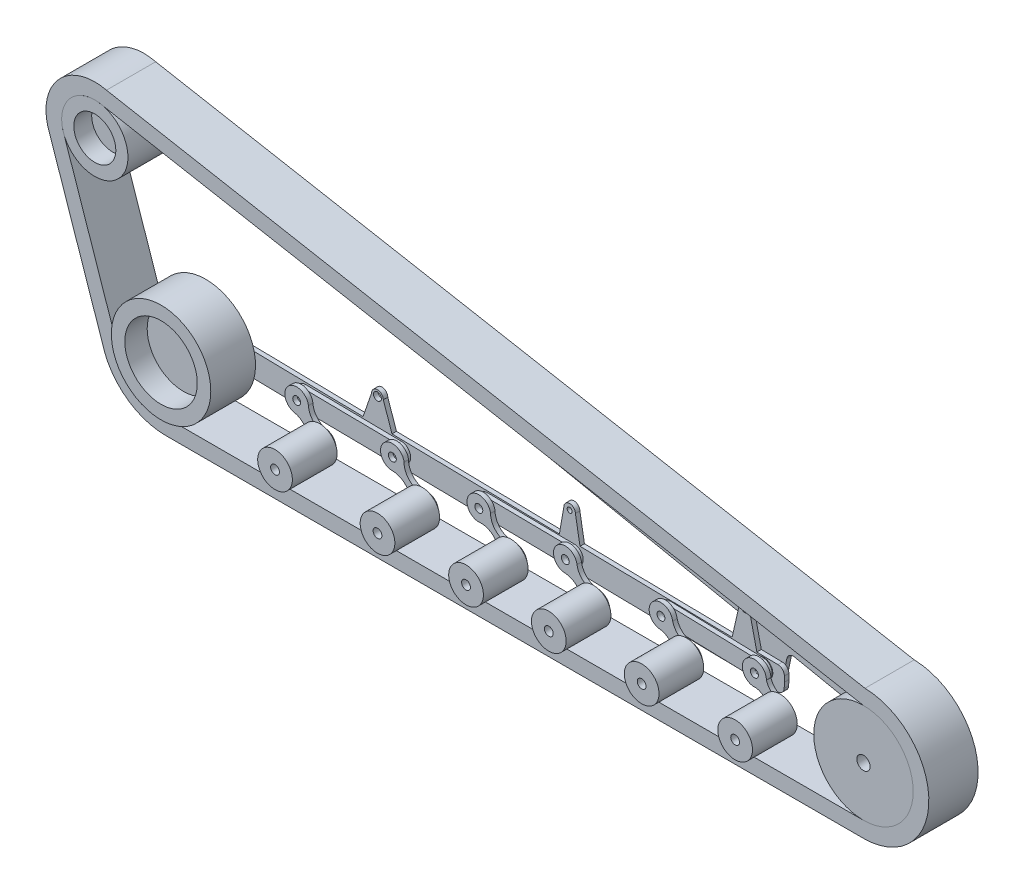
from build123d import *

# Parameters (mm, degrees)
SKETCH3_R                 = 2.011504463
SKETCH3_R_2               = 3.205983498
SKETCH3_R_3               = 2.965791397
BOSS_EXTRUDE2_DEPTH       = 2
SKETCH4_R                 = 1.774931216
SKETCH4_R_2               = 4
SKETCH4_R_3               = 3.435968892
SKETCH4_R_4               = 3.269316706
SKETCH4_R_5               = 4.129646999
SKETCH4_R_6               = 1.115585898
SKETCH4_R_7               = 0.948594568
BOSS_EXTRUDE3_DEPTH       = 2
BOSS_EXTRUDE4_OUTLINE_R   = 3.269316706
BOSS_EXTRUDE4_OUTLINE_R_2 = 3.435968892
BOSS_EXTRUDE4_DEPTH       = 2
SKETCH7_R                 = 1.845913569
BOSS_EXTRUDE5_DEPTH       = 2
SKETCH7_R_2               = 1.755977011
BOSS_EXTRUDE5_2_DEPTH     = 2
SKETCH8_R                 = 1.769310777
SKETCH8_R_2               = 1.845913569
SKETCH8_R_3               = 1.755977011
SKETCH8_R_4               = 1.794044521
BOSS_EXTRUDE6_DEPTH       = 2
SKETCH9_R                 = 22.221
SKETCH9_R_2               = 2.9628
SKETCH9_R_3               = 14.814
SKETCH9_R_4               = 9.386394916
BOSS_EXTRUDE8_DEPTH       = 20
SKETCH14_R                = 7.752666224
SKETCH14_R_2              = 1.97068511
BOSS_EXTRUDE9_DEPTH       = 20
SKETCH15_R                = 9.386394916
SKETCH15_R_2              = 16.195510699
SKETCH15_R_3              = 2.9628
BOSS_EXTRUDE10_DEPTH      = 10
SKETCH16_R                = 22.221
SKETCH16_R_2              = 16.195510699
BOSS_EXTRUDE11_DEPTH      = 20
EXTRUDE_THIN1_DEPTH       = 22


# Read off the part's stored shape, not the designer's step: Boss-Extrude4
with BuildPart() as part:
    # Sketch3 → Boss-Extrude2 (new body)
    with BuildSketch(Plane.XY):
        with BuildLine():
            Line((79.940612246, -11.484870814), (178.015643114, -31.474621784))
            ThreePointArc((178.015643114, -31.474621784), (179.893367454, -32.742130266), (180.324855225, -34.966145724))
            Line((180.324855225, -34.966145724), (179.62512277, -38.399219115))
            ThreePointArc((179.62512277, -38.399219115), (178.357614287, -40.276943453), (176.133598831, -40.708431223))
            Line((176.133598831, -40.708431223), (119.983530321, -29.263868052))
            ThreePointArc((119.983530321, -29.263868052), (117.759514863, -29.695355823), (116.492006381, -31.573080164))
            Line((116.492006381, -31.573080164), (113.761998514, -44.967224307))
            ThreePointArc((113.761998514, -44.967224307), (112.494490031, -46.844948647), (110.270474574, -47.276436418))
            Line((110.270474574, -47.276436418), (101.136830266, -45.414807893))
            ThreePointArc((101.136830266, -45.414807893), (99.259105926, -44.14729941), (98.827618155, -41.923283952))
            Line((98.827618155, -41.923283952), (101.557626022, -28.529139809))
            ThreePointArc((101.557626022, -28.529139809), (101.126138251, -26.305124352), (99.24841391, -25.037615869))
            Line((99.24841391, -25.037615869), (-76.712226623, 10.826858025))
            Line((-76.712226623, 10.826858025), (-80.435820599, 11.585804676))
            Line((-80.435820599, 11.585804676), (-178.186116645, 31.509367866))
            ThreePointArc((-178.186116645, 31.509367866), (-180.063840986, 32.776876349), (-180.495328757, 35.000891806))
            Line((-180.495328757, 35.000891806), (-179.795596301, 38.433965198))
            ThreePointArc((-179.795596301, 38.433965198), (-178.528087819, 40.311689538), (-176.304072361, 40.743177309))
            Line((-176.304072361, 40.743177309), (-7.677221584, 6.373483785))
            Line((-7.677221584, 6.373483785), (-1.829491178, 5.18159352))
            Line((-1.829491178, 5.18159352), (74.881752883, -10.453769034))
            Line((74.881752883, -10.453769034), (75.568358407, -10.59371366))
            Line((75.568358407, -10.59371366), (79.254006721, -11.344926188))
            Line((79.254006721, -11.344926188), (79.940612246, -11.484870814))
        make_face()
        with Locations((107.998913107, -38.459247124)):
            Circle(SKETCH3_R, mode=Mode.SUBTRACT)
        with Locations((-95.0780175, 19.378896702)):
            Circle(SKETCH3_R_2, mode=Mode.SUBTRACT)
        with Locations((75.037518446, -15.217314623)):
            Circle(SKETCH3_R_3, mode=Mode.SUBTRACT)
    extrude(amount=BOSS_EXTRUDE2_DEPTH)

    # Sketch4 → Boss-Extrude3 (add)
    with BuildSketch(Plane.XY.offset(2)):
        with BuildLine():
            Line((-57.960564419, -30.827897593), (16.845335388, -32.158284238))
            Line((16.845335388, -32.158284238), (18.851680364, -20.637860657))
            ThreePointArc((18.851680364, -20.637860657), (21.43043496, -18.059106061), (24.009189556, -20.637860657))
            Line((24.009189556, -20.637860657), (26.044025366, -32.321878478))
            Line((26.044025366, -32.321878478), (94.032084816, -33.531013139))
            Line((94.032084816, -33.531013139), (97.064666462, -20.279293345))
            ThreePointArc((97.064666462, -20.279293345), (99.542978427, -17.80098138), (102.021290391, -20.279293345))
            Line((102.021290391, -20.279293345), (105.098912769, -33.727831307))
            Line((105.098912769, -33.727831307), (114.524247483, -33.895456313))
            ThreePointArc((114.524247483, -33.895456313), (116.566649511, -34.773539155), (117.408276135, -36.831232073))
            Line((117.408276135, -36.831232073), (117.408276135, -39.230754994))
            Line((117.408276135, -39.230754994), (117.322954419, -41.628760509))
            ThreePointArc((117.322954419, -41.628760509), (116.408693022, -43.655225811), (114.336359884, -44.460130083))
            Line((114.336359884, -44.460130083), (-144.866837676, -39.850326935))
            ThreePointArc((-144.866837676, -39.850326935), (-146.945497815, -38.934672964), (-147.749009514, -36.810144989))
            Line((-147.749009514, -36.810144989), (-147.667401425, -34.516512637))
            Line((-147.667401425, -34.516512637), (-147.667401425, -32.221428924))
            ThreePointArc((-147.667401425, -32.221428924), (-146.788854343, -30.126815549), (-144.678950077, -29.285653164))
            Line((-144.678950077, -29.285653164), (-70.892998753, -30.597900521))
            Line((-70.892998753, -30.597900521), (-67.085575555, -19.560338431))
            ThreePointArc((-67.085575555, -19.560338431), (-64.4664505, -16.941213376), (-61.847325444, -19.560338431))
            Line((-61.847325444, -19.560338431), (-57.960564419, -30.827897593))
        make_face()
        with Locations((-64.4664505, -19.560338431)):
            Circle(SKETCH4_R, mode=Mode.SUBTRACT)
        with Locations((-15.160221482, -36.25023678)):
            Circle(SKETCH4_R_2, mode=Mode.SUBTRACT)
        with Locations((-96.560715377, -35.211867515)):
            Circle(SKETCH4_R_3, mode=Mode.SUBTRACT)
        with Locations((-53.809354822, -35.757216772)):
            Circle(SKETCH4_R_4, mode=Mode.SUBTRACT)
        with Locations((66.240272413, -37.288606045)):
            Circle(SKETCH4_R_3, mode=Mode.SUBTRACT)
        with Locations((23.488911858, -36.743256789)):
            Circle(SKETCH4_R_4, mode=Mode.SUBTRACT)
        with Locations((108.104112901, -38.348584041)):
            Circle(SKETCH4_R_5, mode=Mode.SUBTRACT)
        with Locations((21.43043496, -20.637860657)):
            Circle(SKETCH4_R_6, mode=Mode.SUBTRACT)
        with Locations((99.542978427, -20.279293345)):
            Circle(SKETCH4_R_7, mode=Mode.SUBTRACT)
    extrude(amount=BOSS_EXTRUDE3_DEPTH)

    # Boss-Extrude4 outline → Boss-Extrude4 (add)
    with BuildSketch(Plane.XY.offset(4)):
        with BuildLine():
            Line((-96.560715377, -39.392808159), (-53.979820945, -39.934680831))
            ThreePointArc((-53.979820945, -39.934680831), (-49.631890762, -35.927682895), (-53.638888699, -31.579752713))
            Line((-53.638888699, -31.579752713), (-96.560715377, -31.030926872))
            ThreePointArc((-96.560715377, -31.030926872), (-100.741656021, -35.211867515), (-96.560715377, -39.392808159))
        make_face()
        with Locations((-53.809354822, -35.757216772)):
            Circle(BOSS_EXTRUDE4_OUTLINE_R, mode=Mode.SUBTRACT)
        with Locations((-96.560715377, -35.211867515)):
            Circle(BOSS_EXTRUDE4_OUTLINE_R_2, mode=Mode.SUBTRACT)
    extrude(amount=BOSS_EXTRUDE4_DEPTH)



with BuildPart() as body_2:
    # Sketch7 → Boss-Extrude5 (new body)
    with BuildSketch(Plane.XY.offset(4)):
        with BuildLine():
            Line((-15.224657678, -32.257281345), (23.424475662, -32.750301354))
            ThreePointArc((23.424475662, -32.750301354), (27.481867293, -36.678820593), (23.553348054, -40.736212224))
            Line((23.553348054, -40.736212224), (-15.095785286, -40.243192215))
            ThreePointArc((-15.095785286, -40.243192215), (-19.153176917, -36.314672976), (-15.224657678, -32.257281345))
        make_face()
        with Locations((-15.160221482, -36.25023678)):
            Circle(SKETCH7_R, mode=Mode.SUBTRACT)
        with Locations((23.488911858, -36.743256789)):
            Circle(SKETCH7_R, mode=Mode.SUBTRACT)
    extrude(amount=BOSS_EXTRUDE5_DEPTH)


with BuildPart() as body_3:
    # Sketch7 → Boss-Extrude5 2 (new body)
    with BuildSketch(Plane.XY.offset(4)):
        with BuildLine():
            Line((66.301086091, -33.360792691), (108.059726784, -34.531433769))
            ThreePointArc((108.059726784, -34.531433769), (111.926726462, -38.520060801), (107.93809943, -42.387060479))
            Line((107.93809943, -42.387060479), (66.179458736, -41.2164194))
            ThreePointArc((66.179458736, -41.2164194), (62.312459059, -37.227792368), (66.301086091, -33.360792691))
        make_face()
        with Locations((107.998913107, -38.459247124)):
            Circle(SKETCH7_R_2, mode=Mode.SUBTRACT)
        with Locations((66.240272413, -37.288606045)):
            Circle(SKETCH7_R, mode=Mode.SUBTRACT)
    extrude(amount=BOSS_EXTRUDE5_2_DEPTH)


with BuildPart() as part_1:
    add(part.part)

    add(body_2.part)  # Boss-Extrude6 merges body 2

    add(body_3.part)  # Boss-Extrude6 merges body 3
    # Sketch8 → Boss-Extrude6 (add)
    # profile 1 of 6: a face of its own
    with BuildSketch(Plane.XY.offset(6)):
        with BuildLine():
            ThreePointArc((-91.323316121, -34.542502866), (-89.794189154, -38.758666277), (-86.243175967, -41.498113034))
            ThreePointArc((-86.243175967, -41.498113034), (-82.728407266, -50.71826544), (-91.488904888, -46.177506602))
            ThreePointArc((-91.488904888, -46.177506602), (-93.806638546, -42.337926692), (-97.821495904, -40.339131158))
            ThreePointArc((-97.821495904, -40.339131158), (-100.075484077, -31.271715109), (-91.323316121, -34.542502866))
        make_face()
        with Locations((-96.560715377, -35.211867515)):
            Circle(SKETCH8_R, mode=Mode.SUBTRACT)
        with Locations((-86.243175967, -46.778113034)):
            Circle(SKETCH8_R_2, mode=Mode.SUBTRACT)
    # profile 2 of 6: a face of its own
    with BuildSketch(Plane.XY.offset(6)):
        with BuildLine():
            ThreePointArc((-9.922822226, -35.580872131), (-19.13846148, -32.778636786), (-15.1143447, -41.53003747))
            ThreePointArc((-15.1143447, -41.53003747), (-8.843221281, -43.464867862), (-6.107325972, -49.430220697))
            ThreePointArc((-6.107325972, -49.430220697), (3.102299614, -52.186974676), (-0.875940384, -43.435374682))
            ThreePointArc((-0.875940384, -43.435374682), (-7.156774609, -41.532303737), (-9.922822226, -35.580872131))
        make_face()
        with Locations((-15.160221482, -36.25023678)):
            Circle(SKETCH8_R, mode=Mode.SUBTRACT)
        with Locations((-0.875940384, -48.715374682)):
            Circle(SKETCH8_R_2, mode=Mode.SUBTRACT)
    # profile 3 of 6: a face of its own
    with BuildSketch(Plane.XY.offset(6)):
        with BuildLine():
            ThreePointArc((28.726311114, -36.073892139), (31.22725905, -40.765567378), (36.110543743, -42.867967843))
            ThreePointArc((36.110543743, -42.867967843), (40.028146617, -51.687853114), (30.857564688, -48.681457341))
            ThreePointArc((30.857564688, -48.681457341), (28.272517963, -44.035589225), (23.352157883, -42.021485502))
            ThreePointArc((23.352157883, -42.021485502), (19.571308985, -33.203371518), (28.726311114, -36.073892139))
        make_face()
        with Locations((23.488911858, -36.743256789)):
            Circle(SKETCH8_R, mode=Mode.SUBTRACT)
        with Locations((36.110543743, -48.147967843)):
            Circle(SKETCH8_R_2, mode=Mode.SUBTRACT)
    # profile 4 of 6: a face of its own
    with BuildSketch(Plane.XY.offset(6)):
        with BuildLine():
            ThreePointArc((71.477671669, -36.619241396), (73.710803537, -40.422608214), (77.615242457, -42.47390873))
            ThreePointArc((77.615242457, -42.47390873), (81.500901988, -51.32882831), (72.353530206, -48.192980698))
            ThreePointArc((72.353530206, -48.192980698), (69.9846509, -44.472646316), (66.008755562, -42.563527841))
            ThreePointArc((66.008755562, -42.563527841), (62.354612882, -33.713686465), (71.477671669, -36.619241396))
        make_face()
        with Locations((66.240272413, -37.288606045)):
            Circle(SKETCH8_R, mode=Mode.SUBTRACT)
        with Locations((77.615242457, -47.75390873)):
            Circle(SKETCH8_R_2, mode=Mode.SUBTRACT)
    # profile 5 of 6: a face of its own
    with BuildSketch(Plane.XY.offset(6)):
        with BuildLine():
            ThreePointArc((113.368750119, -38.459247124), (115.428785306, -41.819826432), (118.94634036, -43.598602609))
            ThreePointArc((118.94634036, -43.598602609), (123.07423106, -51.902767186), (114.427672842, -48.550803293))
            ThreePointArc((114.427672842, -48.550803293), (112.257890586, -45.383100515), (108.772169367, -43.773118057))
            ThreePointArc((108.772169367, -43.773118057), (103.937668863, -34.946207881), (113.368750119, -38.459247124))
        make_face()
        with Locations((119.400670698, -48.550803293)):
            Circle(SKETCH8_R_3, mode=Mode.SUBTRACT)
        with Locations((107.998913107, -38.459247124)):
            Circle(SKETCH8_R_4, mode=Mode.SUBTRACT)
    # profile 6 of 6: a face of its own
    with BuildSketch(Plane.XY.offset(6)):
        with BuildLine():
            ThreePointArc((-48.571955566, -35.087852123), (-57.630476134, -32.113395712), (-54.229317459, -41.020488699))
            ThreePointArc((-54.229317459, -41.020488699), (-48.338750487, -43.093255062), (-45.712229672, -48.758634842))
            ThreePointArc((-45.712229672, -48.758634842), (-36.617062031, -52.151786174), (-40.438183343, -43.227965114))
            ThreePointArc((-40.438183343, -43.227965114), (-46.221869838, -40.873371694), (-48.571955566, -35.087852123))
        make_face()
        with Locations((-53.809354822, -35.757216772)):
            Circle(SKETCH8_R, mode=Mode.SUBTRACT)
        with Locations((-40.438183343, -48.507965114)):
            Circle(SKETCH8_R_2, mode=Mode.SUBTRACT)
    extrude(amount=BOSS_EXTRUDE6_DEPTH)

    # Sketch9 → Boss-Extrude8 (add)
    # profile 1 of 2: a face of its own
    with BuildSketch(Plane.XY.offset(2)):
        with Locations(Location((170.748826098, -34.802196658, 0), (0, 0, 180.721876814))):
            Circle(SKETCH9_R)
        with Locations(Location((170.748826098, -34.802196658, 0), (0, 0, 180))):
            Circle(SKETCH9_R_2, mode=Mode.SUBTRACT)
    # profile 2 of 2: a face of its own
    with BuildSketch(Plane.XY.offset(2)):
        with Locations(Location((-172.792151235, 35.218669233, 0), (0, 0, 329.933714309))):
            Circle(SKETCH9_R_3)
        with Locations(Location((-172.792151235, 35.218669233, 0), (0, 0, 180))):
            Circle(SKETCH9_R_4, mode=Mode.SUBTRACT)
    extrude(amount=BOSS_EXTRUDE8_DEPTH)

    # Sketch14 → Boss-Extrude9 (add)
    # profile 1 of 6: a face of its own
    with BuildSketch(Plane.XY.offset(8)):
        with Locations(Location((119.400670698, -48.550803293, 0), (0, 0, 156.21736842))):
            Circle(SKETCH14_R)
        with Locations(Location((119.400670698, -48.550803293, 0), (0, 0, 180))):
            Circle(SKETCH14_R_2, mode=Mode.SUBTRACT)
    # profile 2 of 6: a face of its own
    with BuildSketch(Plane.XY.offset(8)):
        with Locations(Location((77.615242457, -47.75390873, 0), (0, 0, 158.263198791))):
            Circle(SKETCH14_R)
        with Locations(Location((77.615242457, -47.75390873, 0), (0, 0, 180))):
            Circle(SKETCH14_R_2, mode=Mode.SUBTRACT)
    # profile 3 of 6: a face of its own
    with BuildSketch(Plane.XY.offset(8)):
        with Locations(Location((36.110543743, -48.147967843, 0), (0, 0, 154.983557818))):
            Circle(SKETCH14_R)
        with Locations(Location((36.110543743, -48.147967843, 0), (0, 0, 180))):
            Circle(SKETCH14_R_2, mode=Mode.SUBTRACT)
    # profile 4 of 6: a face of its own
    with BuildSketch(Plane.XY.offset(8)):
        with Locations(Location((-0.875940384, -48.715374682, 0), (0, 0, 150.06995046))):
            Circle(SKETCH14_R)
        with Locations(Location((-0.875940384, -48.715374682, 0), (0, 0, 180))):
            Circle(SKETCH14_R_2, mode=Mode.SUBTRACT)
    # profile 5 of 6: a face of its own
    with BuildSketch(Plane.XY.offset(8)):
        with Locations(Location((-40.438183343, -48.507965114, 0), (0, 0, 149.127244752))):
            Circle(SKETCH14_R)
        with Locations(Location((-40.438183343, -48.507965114, 0), (0, 0, 180))):
            Circle(SKETCH14_R_2, mode=Mode.SUBTRACT)
    # profile 6 of 6: a face of its own
    with BuildSketch(Plane.XY.offset(8)):
        with Locations(Location((-86.243175967, -46.778113034, 0), (0, 0, 151.762475634))):
            Circle(SKETCH14_R)
        with Locations(Location((-86.243175967, -46.778113034, 0), (0, 0, 180))):
            Circle(SKETCH14_R_2, mode=Mode.SUBTRACT)
    extrude(amount=BOSS_EXTRUDE9_DEPTH)

    # Sketch15 → Boss-Extrude10 (add)
    with BuildSketch(Plane.XY.offset(4)):
        with Locations(Location((-172.792151235, 35.218669233, 0), (0, 0, 318.348306094))):
            Circle(SKETCH15_R)
        with Locations(Location((-141.180202935, -34.802196658, 0), (0, 0, 340.578186486))):
            Circle(SKETCH15_R_2)
        with Locations(Location((170.748826098, -34.802196658, 0), (0, 0, 180))):
            Circle(SKETCH15_R_3)
    extrude(amount=BOSS_EXTRUDE10_DEPTH)

    # Sketch16 → Boss-Extrude11 (add)
    with BuildSketch(Plane.XY.offset(4)):
        with Locations(Location((-141.180202935, -34.802196658, 0), (0, 0, 345.67860856))):
            Circle(SKETCH16_R)
        with Locations(Location((-141.180202935, -34.802196658, 0), (0, 0, 180))):
            Circle(SKETCH16_R_2, mode=Mode.SUBTRACT)
    extrude(amount=BOSS_EXTRUDE11_DEPTH)


with BuildPart() as body_2_2:
    # Sketch17 → Extrude-Thin1 (new body)
    with BuildSketch(Plane.XY):
        with BuildLine():
            Line((-141.180202935, -64.023196658), (170.748826098, -64.023196658))
            ThreePointArc((170.748826098, -64.023196658), (199.967860953, -35.141081793), (171.426550786, -5.589056974))
            Line((171.426550786, -5.589056974), (-167.579524647, 56.40071635))
            ThreePointArc((-167.579524647, 56.40071635), (-188.469240517, 50.387039866), (-193.790786648, 29.310377872))
            Line((-193.790786648, 29.310377872), (-169.403581079, -42.372386033))
            ThreePointArc((-169.403581079, -42.372386033), (-158.965847952, -57.987055346), (-141.180202935, -64.023196658))
        make_face()
        with BuildLine():
            Line((-141.180202935, -57.022196658), (170.748826098, -57.022196658))
            ThreePointArc((170.748826098, -57.022196658), (192.968826098, -34.80215132), (170.748735422, -12.582196659))
            Line((170.748735422, -12.582196659), (-169.067089676, 49.555645392))
            ThreePointArc((-169.067089676, 49.555645392), (-183.311538413, 45.647833266), (-187.096509243, 31.370252545))
            Line((-187.096509243, 31.370252545), (-162.696271418, -40.350817844))
            ThreePointArc((-162.696271418, -40.350817844), (-154.789722347, -52.366631787), (-141.180202935, -57.022196658))
        make_face(mode=Mode.SUBTRACT)
    extrude(amount=EXTRUDE_THIN1_DEPTH)


solid = Compound([part_1.part, body_2_2.part])
